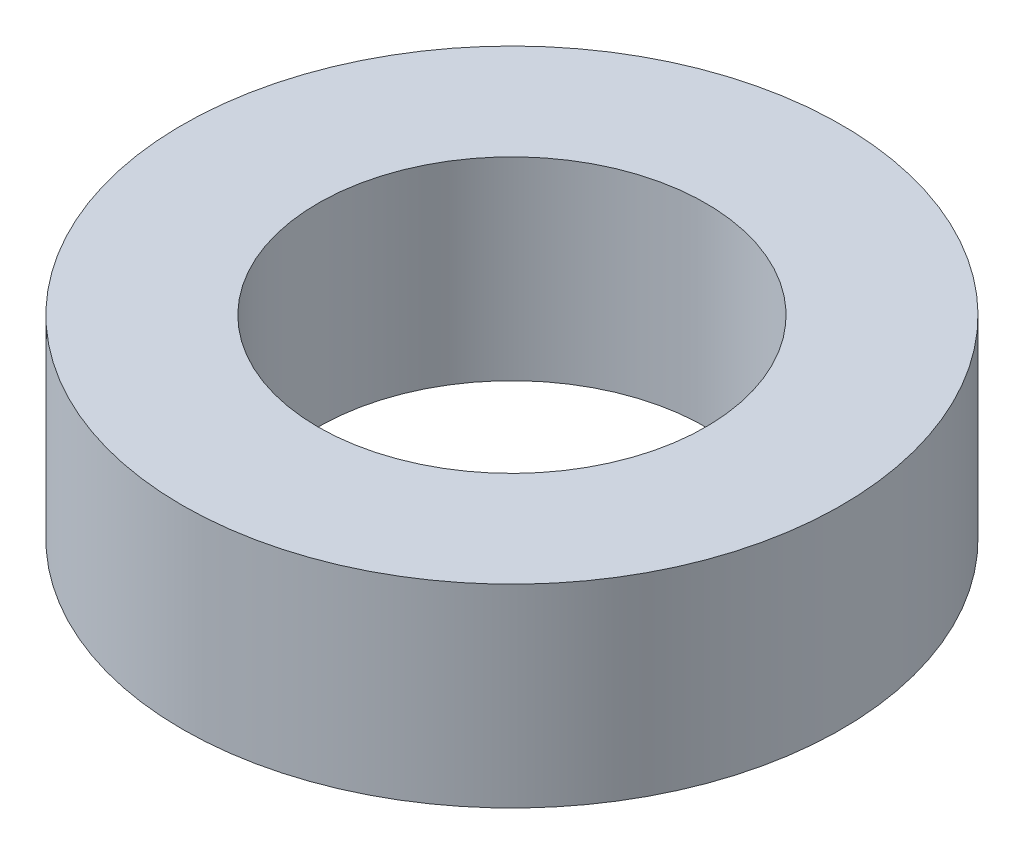
from build123d import *

# Parameters (mm, degrees)
SKETCH1_R           = 42.5
BOSS_EXTRUDE1_DEPTH = 25
SKETCH2_R           = 25
CUT_EXTRUDE1_DEPTH  = 66.096082831


with BuildPart() as part:
    # Sketch1 → Boss-Extrude1 (new body)
    with BuildSketch(Plane(origin=(0, 0, 0), x_dir=(1, 0, 0), z_dir=(0, 1, 0))):
        Circle(SKETCH1_R)
    extrude(amount=BOSS_EXTRUDE1_DEPTH)

    # Sketch2 → Cut-Extrude1 (cut, through all)
    with BuildSketch(Plane(origin=(0, 0, 0), x_dir=(1, 0, 0), z_dir=(0, 1, 0))):
        Circle(SKETCH2_R)
    extrude(amount=CUT_EXTRUDE1_DEPTH, mode=Mode.SUBTRACT)


solid = part.part
